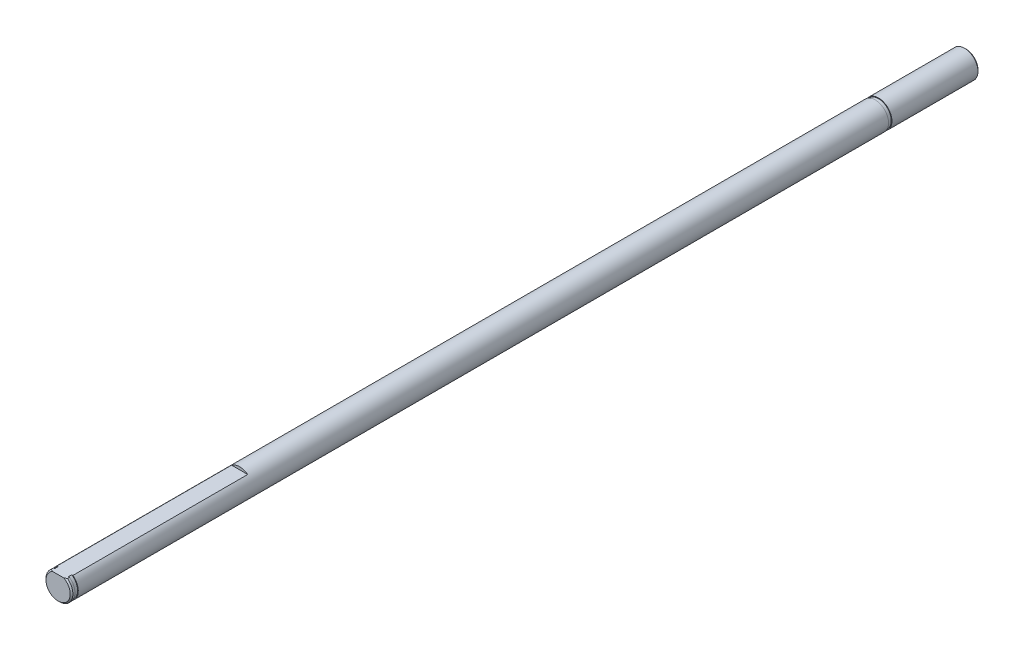
from build123d import *

# Parameters (mm, degrees)
SKIZZE1_R                       = 2
AUFSATZ_LINEAR_AUSTRAGEN1_DEPTH = 67.5
SKIZZE7_W                       = 0.5
SKIZZE7_H                       = 0.1
SCHNITT_LINEAR_AUSTRAGEN1_DEPTH = 27
FASE1_SIZE                      = 0.2


with BuildPart() as part:
    # Skizze1 → Aufsatz-Linear austragen1 (new, symmetric)
    with BuildSketch(Plane.XY):
        Circle(SKIZZE1_R)
    extrude(amount=AUFSATZ_LINEAR_AUSTRAGEN1_DEPTH, both=True)

    # Skizze7 → Schnitt-Rotation1 (revolve, cut)
    with BuildSketch(Plane(origin=(0, 0, 0), x_dir=(0, 0, -1), z_dir=(1, 0, 0))):
        with Locations((-66.75, 1.95)):
            Rectangle(SKIZZE7_W, SKIZZE7_H)
        with Locations((54.25, 1.95)):
            Rectangle(SKIZZE7_W, SKIZZE7_H)
    revolve(axis=Axis((0, 0, -67.5), (0, 0, 1)), mode=Mode.SUBTRACT)

    # Skizze8 → Schnitt-Linear austragen1 (cut)
    with BuildSketch(Plane.XY.offset(67.5)):
        with BuildLine():
            Line((1.2, 1.6), (-1.2, 1.6))
            ThreePointArc((-1.2, 1.6), (0, 2), (1.2, 1.6))
        make_face()
    extrude(amount=-SCHNITT_LINEAR_AUSTRAGEN1_DEPTH, mode=Mode.SUBTRACT)

    # Fase1
    fase1_edges = [part.edges().sort_by_distance(p)[0] for p in [
        (0, -2, 67.5),
        (-2, 0, -67.5),
    ]]
    chamfer(fase1_edges, length=FASE1_SIZE)


solid = part.part
